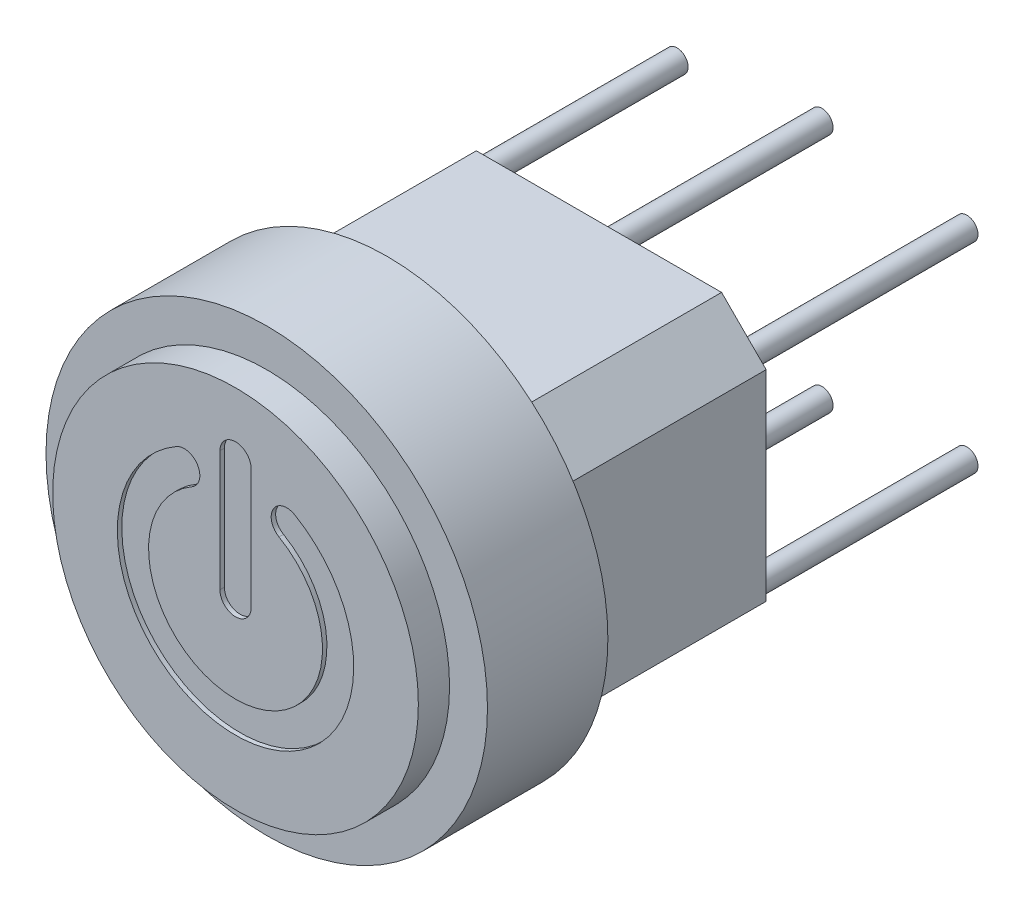
from build123d import *

# Parameters (mm, degrees)
ESQUISSE1_R             = 4.95
BOSS_EXTRU_1_DEPTH      = 2.7
ESQUISSE2_W             = 7.5
ESQUISSE2_H             = 6.5
BOSS_EXTRU_2_DEPTH      = 4.75
ESQUISSE3_R             = 4.1
BOSS_EXTRU_3_DEPTH      = 0.7
CHANFREIN1_SIZE         = 1
ESQUISSE4_R             = 0.25
BOSS_EXTRU_4_DEPTH      = 5
ENL_V_MAT_EXTRU_1_DEPTH = 0.1


with BuildPart() as part:
    # Esquisse1 → Boss.-Extru.1 (new body)
    with BuildSketch(Plane.XY):
        with Locations(Location((0, 0, 0), (0, 0, 180))):
            Circle(ESQUISSE1_R)
    extrude(amount=BOSS_EXTRU_1_DEPTH)

    # Esquisse2 → Boss.-Extru.2 (add)
    with BuildSketch(Plane(origin=(0, 0, 0), x_dir=(-1, 0, 0), z_dir=(0, 0, -1))):
        Rectangle(ESQUISSE2_W, ESQUISSE2_H)
    extrude(amount=BOSS_EXTRU_2_DEPTH)

    # Esquisse3 → Boss.-Extru.3 (add)
    with BuildSketch(Plane.XY.offset(2.7)):
        Circle(ESQUISSE3_R)
    extrude(amount=BOSS_EXTRU_3_DEPTH)

    # Chanfrein1
    # the kernel refuses this chamfer: 1 mm, written as the material it takes off along each edge
    with BuildSketch(Plane(origin=(-3.75, -3.25, 0), x_dir=(-0.027495876610586487, 0.9996219169112968, 0), z_dir=(0, 0, -1)), Plane(origin=(3.75, 3.25, 0), x_dir=(0.027495876610586487, -0.9996219169112968, 0), z_dir=(0, 0, -1)), Plane(origin=(3.75, -3.25, 0), x_dir=(-0.9996219169112968, -0.027495876610586473, 0), z_dir=(0, 0, -1))) as chanfrein1_piece_1:
        Polygon((CHANFREIN1_SIZE * 0.999621916911, CHANFREIN1_SIZE * 0.0274958766106), (-CHANFREIN1_SIZE * 0.0274958766106, CHANFREIN1_SIZE * 0.999621916911), (0, 0), align=None)
    extrude(amount=7.321682988, mode=Mode.SUBTRACT)
    with BuildSketch(Plane(origin=(-3.75, 3.25, 0), x_dir=(-0.027495876610586487, -0.9996219169112968, 0), z_dir=(0, 0, -1))) as chanfrein1_piece_2:
        Polygon((CHANFREIN1_SIZE * 0.999621916911, -CHANFREIN1_SIZE * 0.0274958766106), (-CHANFREIN1_SIZE * 0.0274958766106, -CHANFREIN1_SIZE * 0.999621916911), (0, 0), align=None)
    extrude(amount=7.321682988, mode=Mode.SUBTRACT)

    # Esquisse4 → Boss.-Extru.4 (add)
    with BuildSketch(Plane(origin=(0, 0, -4.75), x_dir=(-1, 0, 0), z_dir=(0, 0, -1))):
        with Locations((-3.25, 2.25)):
            Circle(ESQUISSE4_R)
        with Locations((0, 2.7)):
            Circle(ESQUISSE4_R)
        with Locations((3.25, 2.25)):
            Circle(ESQUISSE4_R)
        with Locations(Location((3.25, -2.25, 0), (0, 0, 180))):
            Circle(ESQUISSE4_R)
        with Locations(Location((0, -2.7, 0), (0, 0, 180))):
            Circle(ESQUISSE4_R)
        with Locations(Location((-3.25, -2.25, 0), (0, 0, 180))):
            Circle(ESQUISSE4_R)
    extrude(amount=BOSS_EXTRU_4_DEPTH)

    # Esquisse5 → Enlèv. mat.-Extru.1 (cut)
    with BuildSketch(Plane.XY.offset(3.4)):
        with BuildLine():
            Line((-0.35, 2.7), (-0.35, 0))
            ThreePointArc((-0.35, 0), (0, -0.35), (0.35, 0))
            Line((0.35, 0), (0.35, 2.7))
            ThreePointArc((0.35, 2.7), (0, 3.05), (-0.35, 2.7))
        make_face()
        with BuildLine():
            ThreePointArc((-1.325, 2.29496732), (0, -2.65), (1.325, 2.29496732))
            ThreePointArc((1.325, 2.29496732), (0.846891109, 2.166858429), (0.975, 1.688749537))
            ThreePointArc((0.975, 1.688749537), (0, -1.95), (-0.975, 1.688749537))
            ThreePointArc((-0.975, 1.688749537), (-0.846891109, 2.166858429), (-1.325, 2.29496732))
        make_face()
    extrude(amount=-ENL_V_MAT_EXTRU_1_DEPTH, mode=Mode.SUBTRACT)


solid = part.part
